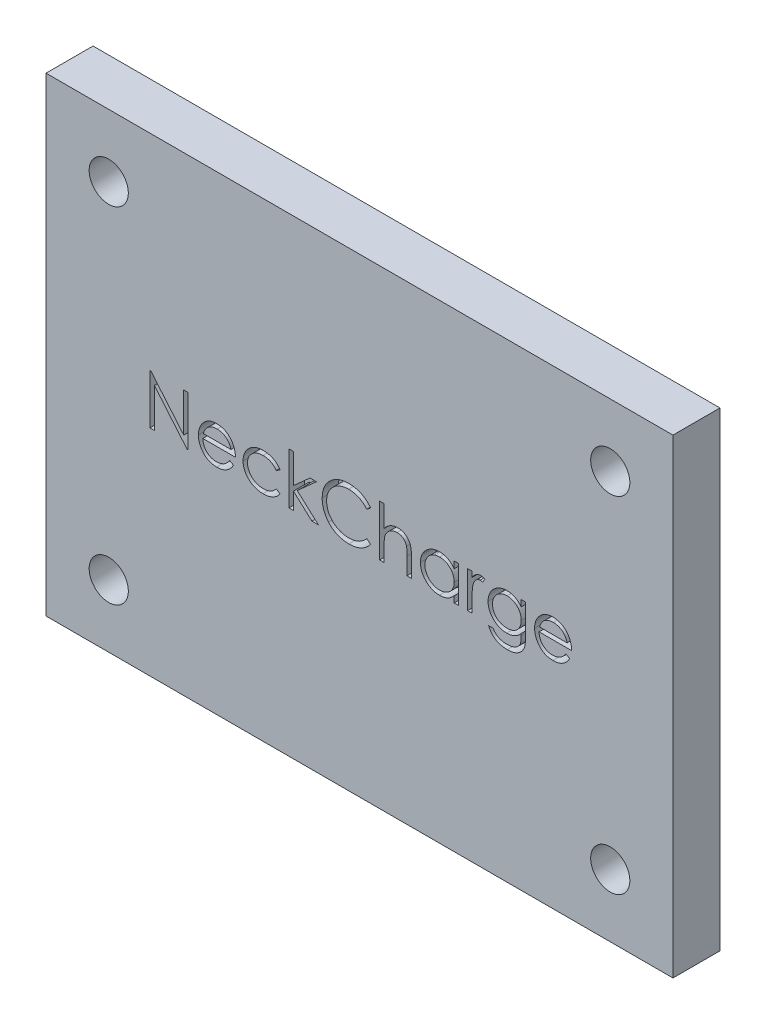
from build123d import *

# Parameters (mm, degrees)
SKETCH1_W           = 40
SKETCH1_H           = 30
SKETCH1_W_2         = 36
SKETCH1_H_2         = 26
EXTRUDE_THIN1_DEPTH = 1
SKETCH1_3_W         = 40
SKETCH1_3_H         = 30
SKETCH1_3_W_2       = 36
SKETCH1_3_H_2       = 26
BOSS_EXTRUDE1_DEPTH = 2
SKETCH2_R           = 1.25
CUT_EXTRUDE1_DEPTH  = 2
WRAP1_START         = -1
WRAP1_DEPTH         = 1


# Read off the part's stored shape, not the designer's step: Wrap1
with BuildPart() as part:
    # Sketch1 → Extrude-Thin1 (new body)
    # profile 1 of 2: a face of its own
    with BuildSketch(Plane.XY):
        with Locations((1.25, 0)):
            Rectangle(SKETCH1_W, SKETCH1_H)
        with Locations((1.25, 0)):
            Rectangle(SKETCH1_W_2, SKETCH1_H_2, mode=Mode.SUBTRACT)
    # profile 2 of 2: a face of its own
    with BuildSketch(Plane.XY):
        with Locations((1.25, 0)):
            Rectangle(SKETCH1_W, SKETCH1_H)
        with Locations((1.25, 0)):
            Rectangle(SKETCH1_W_2, SKETCH1_H_2, mode=Mode.SUBTRACT)
    extrude(amount=-EXTRUDE_THIN1_DEPTH)

    # Sketch1<3> → Boss-Extrude1 (add)
    # profile 1 of 2: a face of its own
    with BuildSketch(Plane.XY):
        with Locations((1.25, 0)):
            Rectangle(SKETCH1_3_W, SKETCH1_3_H)
        with Locations((1.25, 0)):
            Rectangle(SKETCH1_3_W_2, SKETCH1_3_H_2, mode=Mode.SUBTRACT)
    # profile 2 of 2: a face of its own
    with BuildSketch(Plane.XY):
        with Locations((1.25, 0)):
            Rectangle(SKETCH1_3_W_2, SKETCH1_3_H_2)
    extrude(amount=BOSS_EXTRUDE1_DEPTH)

    # Sketch2 → Cut-Extrude1 (cut)
    with BuildSketch(Plane(origin=(0, 0, 0), x_dir=(-1, 0, 0), z_dir=(0, 0, -1))):
        with Locations((-17.25, 11)):
            Circle(SKETCH2_R)
        with Locations((14.75, 11)):
            Circle(SKETCH2_R)
        with Locations((14.75, -11)):
            Circle(SKETCH2_R)
        with Locations((-17.25, -11)):
            Circle(SKETCH2_R)
    extrude(amount=-CUT_EXTRUDE1_DEPTH, mode=Mode.SUBTRACT)

    # Wrap1 outline → Wrap1 (cut)
    # profile 1 of 10: a face of its own
    with BuildSketch(Plane.XY.offset(2).offset(WRAP1_START)):
        with BuildLine():
            add(Edge.make_bspline(
                [(14.662320676, -0.641993919), (14.642148907, -0.677774655), (14.602902634, -0.747389798), (14.535410527, -0.843031557), (14.464660575, -0.929071985), (14.387459119, -1.003212457), (14.30611591, -1.067847642), (14.220179859, -1.124396955), (14.129203574, -1.172583041), (14.033182752, -1.213179977), (13.931311017, -1.244394304), (13.823341498, -1.266441704), (13.709067356, -1.280069955), (13.630739036, -1.281653047), (13.590630972, -1.28246367)],
                knots=[0, 0, 0, 0, 0.093369857, 0.181660766, 0.265874227, 0.346354784, 0.424599862, 0.501903184, 0.579992091, 0.658443431, 0.738672236, 0.821894148, 0.908800792, 1, 1, 1, 1], degree=3))
            Line((14.662320676, -0.641993919), (14.40918566, -0.509066234))
            add(Edge.make_bspline(
                [(13.555013985, -0.997527773), (13.583453955, -0.996976179), (13.63988431, -0.99588171), (13.723922802, -0.985239191), (13.806599373, -0.968030441), (13.887571837, -0.944544521), (13.965196818, -0.915899805), (14.037083853, -0.88133507), (14.10319662, -0.843099228), (14.16498844, -0.799366166), (14.224924269, -0.745837311), (14.284380668, -0.679039192), (14.348131632, -0.600038363), (14.388036477, -0.540579081), (14.40918566, -0.509066234)],
                knots=[0, 0, 0, 0, 0.082592263, 0.163878894, 0.24565874, 0.327725695, 0.408609961, 0.485749086, 0.559169056, 0.630268476, 0.705306028, 0.792064966, 0.889796437, 1, 1, 1, 1], degree=3))
            add(Edge.make_bspline(
                [(12.708474522, -0.142720081), (12.709871165, -0.173291216), (12.712617607, -0.233408121), (12.725422058, -0.321374474), (12.745604874, -0.405170292), (12.773970381, -0.484167051), (12.80832102, -0.559396524), (12.850399491, -0.630300657), (12.900600372, -0.696556494), (12.9565944, -0.758756683), (13.01892155, -0.814147516), (13.084492328, -0.863724485), (13.154245776, -0.905276705), (13.227631895, -0.939004176), (13.304532014, -0.965407763), (13.384970363, -0.983430714), (13.468788654, -0.995502161), (13.525925713, -0.996844429), (13.555013985, -0.997527773)],
                knots=[0, 0, 0, 0, 0.068384615, 0.134475588, 0.198391058, 0.260753477, 0.321829223, 0.383037238, 0.444653123, 0.507398011, 0.569825238, 0.630777641, 0.690928687, 0.750945133, 0.811049477, 0.872330853, 0.935004094, 1, 1, 1, 1], degree=3))
            Line((12.708474522, -0.142720081), (14.78443606, -0.142720081))
            add(Edge.make_bspline(
                [(14.531937062, 0.662478237), (14.552009356, 0.635079274), (14.592020337, 0.580463723), (14.642137349, 0.491408459), (14.685641557, 0.398235277), (14.720415029, 0.299438079), (14.748572291, 0.19618746), (14.768943834, 0.087745294), (14.780890559, -0.025856125), (14.783238877, -0.103259501), (14.78443606, -0.142720081)],
                knots=[0, 0, 0, 0, 0.11852184, 0.236254763, 0.356174434, 0.477249655, 0.601539871, 0.729618382, 0.862158266, 1, 1, 1, 1], degree=3))
            add(Edge.make_bspline(
                [(13.597627166, 1.119138894), (13.645204637, 1.117910578), (13.738540788, 1.115500903), (13.874641355, 1.0931613), (14.003420005, 1.057735054), (14.124825206, 1.007702687), (14.238869265, 0.943150808), (14.344810896, 0.863193566), (14.444461911, 0.77028573), (14.502436121, 0.698836247), (14.531937062, 0.662478237)],
                knots=[0, 0, 0, 0, 0.132040234, 0.259032841, 0.381879824, 0.502258444, 0.62275219, 0.744742632, 0.870108927, 1, 1, 1, 1], degree=3))
            add(Edge.make_bspline(
                [(12.690666028, 0.686646907), (12.719429426, 0.720999382), (12.776045071, 0.788616132), (12.871799764, 0.877460185), (12.975486371, 0.95188561), (13.085805489, 1.013577798), (13.204039291, 1.060453177), (13.328598433, 1.095385055), (13.460901215, 1.114959394), (13.551348094, 1.117724215), (13.597627166, 1.119138894)],
                knots=[0, 0, 0, 0, 0.128835254, 0.253589335, 0.374643257, 0.495340042, 0.616324775, 0.739759335, 0.86684232, 1, 1, 1, 1], degree=3))
            add(Edge.make_bspline(
                [(12.423538624, -0.088022564), (12.424499417, -0.05237654), (12.426403581, 0.018269174), (12.438405795, 0.122831489), (12.459676747, 0.2244573), (12.488865269, 0.323231049), (12.526558185, 0.418987356), (12.57267027, 0.5117845), (12.627273355, 0.601523734), (12.669430709, 0.658132291), (12.690666028, 0.686646907)],
                knots=[0, 0, 0, 0, 0.128044808, 0.2537679, 0.377428427, 0.500550841, 0.623295883, 0.746578332, 0.872347541, 1, 1, 1, 1], degree=3))
            add(Edge.make_bspline(
                [(13.590630972, -1.28246367), (13.546052178, -1.281423018), (13.459091866, -1.279393008), (13.332509381, -1.261891987), (13.21332948, -1.233342061), (13.101558864, -1.193459034), (12.997471249, -1.141364247), (12.900859759, -1.077901003), (12.811216332, -1.003395315), (12.731365799, -0.917201827), (12.659480277, -0.824961766), (12.596047569, -0.728844642), (12.543018328, -0.629092288), (12.499881317, -0.526339742), (12.465042618, -0.421234638), (12.440761394, -0.312820664), (12.426764409, -0.201391241), (12.424619519, -0.126010087), (12.423538624, -0.088022564)],
                knots=[0, 0, 0, 0, 0.071578658, 0.139629225, 0.204796697, 0.268134963, 0.329813747, 0.391301398, 0.453433515, 0.51655169, 0.579631271, 0.641118921, 0.701294047, 0.760810336, 0.819931722, 0.878919575, 0.938982822, 1, 1, 1, 1], degree=3))
        make_face()
        with BuildLine():
            add(Edge.make_bspline(
                [(13.612255572, 0.834202996), (13.583817152, 0.833648123), (13.527600376, 0.832551255), (13.444777265, 0.822146209), (13.365239252, 0.804946921), (13.288399455, 0.781392996), (13.215264811, 0.74999805), (13.144330985, 0.713183265), (13.077401626, 0.668241972), (13.035544879, 0.633989296), (13.014399001, 0.616684968)],
                knots=[0, 0, 0, 0, 0.131091976, 0.259141276, 0.384161763, 0.505991952, 0.629098089, 0.750669123, 0.874038938, 1, 1, 1, 1], degree=3))
            add(Edge.make_bspline(
                [(14.499500163, 0.142215817), (14.489071082, 0.180009995), (14.468998459, 0.252751622), (14.427055471, 0.353481573), (14.379819145, 0.443005598), (14.323919431, 0.52063855), (14.260583873, 0.589584594), (14.187427172, 0.649835739), (14.105388897, 0.703735856), (14.014893105, 0.749231337), (13.919060914, 0.787957138), (13.818725297, 0.813924207), (13.716347161, 0.831712863), (13.647101058, 0.833369405), (13.612255572, 0.834202996)],
                knots=[0, 0, 0, 0, 0.096240125, 0.185231261, 0.267500523, 0.344400382, 0.419594869, 0.496890627, 0.576637919, 0.660267852, 0.745386615, 0.830040327, 0.914474212, 1, 1, 1, 1], degree=3))
            Line((14.499500163, 0.142215817), (12.73836735, 0.142215817))
            add(Edge.make_bspline(
                [(13.014399001, 0.616684968), (12.99925581, 0.602992267), (12.968609681, 0.575281578), (12.927660779, 0.527539369), (12.888453636, 0.476057595), (12.852772394, 0.418866661), (12.820044869, 0.356617811), (12.789419747, 0.289836099), (12.76185493, 0.21801476), (12.746346316, 0.167965475), (12.73836735, 0.142215817)],
                knots=[0, 0, 0, 0, 0.109983845, 0.222580497, 0.338499871, 0.458708565, 0.585535346, 0.717517743, 0.85466682, 1, 1, 1, 1], degree=3))
        make_face(mode=Mode.SUBTRACT)
    # profile 2 of 10: a face of its own
    with BuildSketch(Plane.XY.offset(2).offset(WRAP1_START)):
        with BuildLine():
            add(Edge.make_bspline(
                [(11.853672014, -0.768387875), (11.853420697, -0.807610551), (11.852935594, -0.883319761), (11.849442213, -0.992792201), (11.842075598, -1.093907864), (11.833722009, -1.187127913), (11.821705345, -1.272020256), (11.807031069, -1.348838206), (11.790488703, -1.41765548), (11.775956077, -1.460041586), (11.769081669, -1.480091601)],
                knots=[0, 0, 0, 0, 0.163445255, 0.315488713, 0.456290824, 0.58586415, 0.705428686, 0.813370713, 0.911718238, 1, 1, 1, 1], degree=3))
            Line((11.853672014, -0.768387875), (11.853672014, 1.072883158))
            Line((11.853672014, 1.072883158), (11.568736116, 1.072883158))
            Line((11.568736116, 1.072883158), (11.568736116, 0.667103911))
            add(Edge.make_bspline(
                [(10.650326661, 1.113588286), (10.693008584, 1.11235759), (10.777292268, 1.109927343), (10.90132682, 1.090858161), (11.021017281, 1.060456163), (11.137039052, 1.016899127), (11.25033725, 0.957435878), (11.360538466, 0.879110489), (11.467961538, 0.781220395), (11.53425357, 0.706151725), (11.568736116, 0.667103911)],
                knots=[0, 0, 0, 0, 0.120911079, 0.238762229, 0.354754859, 0.470359399, 0.589144099, 0.716328905, 0.852445286, 1, 1, 1, 1], degree=3))
            add(Edge.make_bspline(
                [(9.45206945, -0.079580784), (9.452540408, -0.053270833), (9.4534805, -0.000752832), (9.461600317, 0.077152039), (9.473182888, 0.154013741), (9.491514222, 0.229040026), (9.513578224, 0.303085337), (9.540904608, 0.375602751), (9.573760197, 0.446614356), (9.610961898, 0.516172738), (9.652766754, 0.583344503), (9.698606933, 0.647140817), (9.748537776, 0.70709223), (9.801870442, 0.763803556), (9.859256133, 0.816727625), (9.920665162, 0.865735986), (9.985492203, 0.911650138), (10.053938173, 0.953479708), (10.124946947, 0.990475032), (10.196714482, 1.024232173), (10.270191452, 1.051023839), (10.34400797, 1.074630507), (10.419464035, 1.091353863), (10.495634457, 1.104255468), (10.572780006, 1.112115608), (10.624444418, 1.11309676), (10.650326661, 1.113588286)],
                knots=[0, 0, 0, 0, 0.042034119, 0.083905433, 0.125068934, 0.16615847, 0.207210273, 0.248490732, 0.289878112, 0.332169514, 0.374475842, 0.41622498, 0.457609587, 0.49907317, 0.540553362, 0.582248849, 0.62454975, 0.667432801, 0.710322543, 0.752467119, 0.794064757, 0.835215707, 0.876228344, 0.917446189, 0.95864314, 1, 1, 1, 1], degree=3))
            add(Edge.make_bspline(
                [(10.641422414, -1.247309149), (10.614900941, -1.246841947), (10.56217185, -1.245913071), (10.483835758, -1.23778618), (10.406655646, -1.225994463), (10.330811515, -1.208684872), (10.256193923, -1.186467378), (10.182926179, -1.158693622), (10.110415051, -1.127292764), (10.039978585, -1.090306007), (9.972318309, -1.049155914), (9.907944563, -1.004579921), (9.847194531, -0.956811331), (9.79064643, -0.905379107), (9.738374435, -0.850357688), (9.689675498, -0.792333607), (9.645354904, -0.730496635), (9.604503187, -0.665974323), (9.569072409, -0.598336914), (9.537971586, -0.52905107), (9.510930197, -0.45826494), (9.489371583, -0.385741533), (9.47290593, -0.311526571), (9.460650224, -0.235741636), (9.45369885, -0.158153355), (9.452614883, -0.10588256), (9.45206945, -0.079580784)],
                knots=[0, 0, 0, 0, 0.042864759, 0.085222258, 0.127202284, 0.169025313, 0.210882033, 0.252962678, 0.295628285, 0.338553294, 0.381463248, 0.423581562, 0.465066165, 0.506312219, 0.547039505, 0.587675833, 0.628674786, 0.669946465, 0.711035574, 0.751995829, 0.792672607, 0.833446018, 0.874190607, 0.915493583, 0.957477807, 1, 1, 1, 1], degree=3))
            add(Edge.make_bspline(
                [(11.568736116, -0.802732827), (11.539815388, -0.837151462), (11.482482639, -0.905383319), (11.383470421, -0.994792803), (11.275323648, -1.07179665), (11.158226434, -1.134950697), (11.0350471, -1.185461704), (10.907119791, -1.220788532), (10.775591284, -1.243612156), (10.686462548, -1.246068079), (10.641422414, -1.247309149)],
                knots=[0, 0, 0, 0, 0.126560713, 0.250895262, 0.374719265, 0.499826424, 0.624963531, 0.749039475, 0.87318012, 1, 1, 1, 1], degree=3))
            Line((11.568736116, -0.802732827), (11.568736116, -0.922940159))
            add(Edge.make_bspline(
                [(10.650326661, -1.857886073), (10.700008055, -1.856588723), (10.795788808, -1.854087564), (10.933521369, -1.833729333), (11.059246777, -1.799644861), (11.172240673, -1.751921539), (11.271169835, -1.693455813), (11.356452141, -1.62814146), (11.42552624, -1.554498693), (11.471983717, -1.486660912), (11.500862263, -1.426223308), (11.519252078, -1.374196311), (11.534196321, -1.315365486), (11.546696603, -1.249928068), (11.557011645, -1.177790565), (11.563545689, -1.098788035), (11.568268103, -1.013100026), (11.568576505, -0.953688393), (11.568736116, -0.922940159)],
                knots=[0, 0, 0, 0, 0.098171298, 0.189264436, 0.274463056, 0.355023171, 0.430920462, 0.501086045, 0.566607627, 0.629720863, 0.662710695, 0.698765562, 0.738610537, 0.782581228, 0.830408787, 0.882577866, 0.939228681, 1, 1, 1, 1], degree=3))
            add(Edge.make_bspline(
                [(9.777710475, -1.410129662), (9.800626908, -1.446511421), (9.845425712, -1.517633279), (9.929198977, -1.609720214), (10.021007573, -1.688417909), (10.123949857, -1.751836968), (10.23845416, -1.799652279), (10.364589368, -1.833738441), (10.503381882, -1.854145768), (10.600009119, -1.856605299), (10.650326661, -1.857886073)],
                knots=[0, 0, 0, 0, 0.124716487, 0.243805374, 0.360061534, 0.475112, 0.593525098, 0.71935017, 0.853854771, 1, 1, 1, 1], degree=3))
            Line((9.777710475, -1.410129662), (9.492774578, -1.410129662))
            add(Edge.make_bspline(
                [(10.677675419, -2.14282197), (10.62970141, -2.142045015), (10.535995281, -2.140527413), (10.399375037, -2.122846369), (10.269622113, -2.097850616), (10.148450999, -2.060017835), (10.036627411, -2.013719995), (9.934915038, -1.960566002), (9.844226962, -1.8996157), (9.762471916, -1.830218726), (9.688683473, -1.747701672), (9.619262289, -1.650457006), (9.552441291, -1.537003471), (9.51328117, -1.453734367), (9.492774578, -1.410129662)],
                knots=[0, 0, 0, 0, 0.096491424, 0.188473675, 0.276839915, 0.362136562, 0.443436755, 0.520165521, 0.592709664, 0.662917334, 0.7354188, 0.81488097, 0.903060556, 1, 1, 1, 1], degree=3))
            add(Edge.make_bspline(
                [(11.769081669, -1.480091601), (11.758931431, -1.506153745), (11.738934441, -1.55749879), (11.701482473, -1.630282781), (11.659541718, -1.698814149), (11.611638451, -1.762710979), (11.557989293, -1.821652507), (11.499858225, -1.876919278), (11.436113123, -1.927342058), (11.366790434, -1.972050864), (11.293488181, -2.012316263), (11.216248503, -2.047192792), (11.135506948, -2.077570143), (11.050505039, -2.100323822), (10.96257547, -2.120040318), (10.870684229, -2.132871569), (10.775368191, -2.141604686), (10.710557025, -2.142412254), (10.677675419, -2.14282197)],
                knots=[0, 0, 0, 0, 0.061370706, 0.120906468, 0.179423665, 0.237606687, 0.295938468, 0.354218227, 0.413537067, 0.474086783, 0.535121189, 0.596987665, 0.660019834, 0.724277496, 0.79001185, 0.857747684, 0.927829032, 1, 1, 1, 1], degree=3))
        make_face()
        with BuildLine():
            add(Edge.make_bspline(
                [(9.737005347, -0.091029101), (9.737663712, -0.121811427), (9.738958524, -0.18235126), (9.751407769, -0.271194922), (9.771529074, -0.355813492), (9.800047111, -0.436212089), (9.83538277, -0.512851867), (9.879825849, -0.585204887), (9.932123516, -0.653335585), (9.991866437, -0.716740046), (10.057703583, -0.774489639), (10.129113143, -0.825233433), (10.205998262, -0.866735873), (10.286468011, -0.902605061), (10.372474912, -0.928802501), (10.462780154, -0.948794822), (10.558022621, -0.960232767), (10.622948413, -0.961650448), (10.65605082, -0.962373252)],
                knots=[0, 0, 0, 0, 0.064983044, 0.127802645, 0.189056336, 0.248394647, 0.307690706, 0.366976619, 0.427340044, 0.488794715, 0.550673693, 0.612045111, 0.673369139, 0.734929754, 0.797809968, 0.862891673, 0.930095338, 1, 1, 1, 1], degree=3))
            add(Edge.make_bspline(
                [(10.673223296, 0.828652389), (10.631557586, 0.82723628), (10.549068315, 0.824432683), (10.428156747, 0.800497979), (10.311428386, 0.762991341), (10.201114891, 0.70934054), (10.09778487, 0.643940767), (10.006095568, 0.564710649), (9.92589968, 0.474226599), (9.858060872, 0.373306732), (9.804057418, 0.264429382), (9.765827316, 0.149666073), (9.741107652, 0.030871187), (9.738379282, -0.050202531), (9.737005347, -0.091029101)],
                knots=[0, 0, 0, 0, 0.085518899, 0.169309287, 0.252217903, 0.336756454, 0.420595494, 0.502741104, 0.584803551, 0.668268485, 0.75182313, 0.833628628, 0.916219799, 1, 1, 1, 1], degree=3))
            add(Edge.make_bspline(
                [(11.568736116, -0.074492643), (11.567520937, -0.03220359), (11.565146903, 0.05041436), (11.542743052, 0.170798356), (11.506620433, 0.283981368), (11.455959451, 0.389605431), (11.392475771, 0.48655138), (11.31601193, 0.573023725), (11.227886602, 0.649133787), (11.128352983, 0.712541434), (11.021267086, 0.76376365), (10.909215715, 0.802191829), (10.792365225, 0.8239581), (10.713165839, 0.82707862), (10.673223296, 0.828652389)],
                knots=[0, 0, 0, 0, 0.089242793, 0.174349058, 0.257613109, 0.339527367, 0.42099739, 0.501579059, 0.58254176, 0.666132658, 0.750049131, 0.83274294, 0.915647421, 1, 1, 1, 1], degree=3))
            add(Edge.make_bspline(
                [(10.65605082, -0.962373252), (10.689582229, -0.961676921), (10.755152545, -0.960315253), (10.850920465, -0.948609936), (10.941664451, -0.929721429), (11.027301297, -0.902903542), (11.108154342, -0.868684525), (11.183315314, -0.825380594), (11.254395806, -0.776064288), (11.319126264, -0.718540532), (11.3776589, -0.655144858), (11.428668238, -0.586161275), (11.472133488, -0.512627804), (11.508126803, -0.434552734), (11.535605253, -0.351329314), (11.554037402, -0.263165591), (11.566924949, -0.17048395), (11.568123217, -0.106976133), (11.568736116, -0.074492643)],
                knots=[0, 0, 0, 0, 0.070121499, 0.137121849, 0.201487121, 0.263765119, 0.324560095, 0.384738887, 0.444904604, 0.50523192, 0.565493995, 0.625099744, 0.684349714, 0.743882825, 0.804608206, 0.867238914, 0.932094288, 1, 1, 1, 1], degree=3))
        make_face(mode=Mode.SUBTRACT)
    # profile 3 of 10: a face of its own
    with BuildSketch(Plane.XY.offset(2).offset(WRAP1_START)):
        with BuildLine():
            add(Edge.make_bspline(
                [(8.434443517, 0.728908549), (8.455479034, 0.760709193), (8.495709297, 0.821527678), (8.562577454, 0.901963401), (8.631069762, 0.968561336), (8.70151411, 1.021632386), (8.774428529, 1.061377143), (8.848212764, 1.090490111), (8.924027654, 1.107705247), (8.974974543, 1.110003637), (9.000499206, 1.111155143)],
                knots=[0, 0, 0, 0, 0.160059412, 0.306112383, 0.438366514, 0.560541455, 0.675317225, 0.786113634, 0.892841788, 1, 1, 1, 1], degree=3))
            Line((8.434443517, 0.728908549), (8.434443517, 1.070450015))
            Line((8.434443517, 1.070450015), (8.14950762, 1.070450015))
            Line((8.14950762, 1.070450015), (8.14950762, -1.249742292))
            Line((8.14950762, -1.249742292), (8.434443517, -1.249742292))
            Line((8.434443517, -1.249742292), (8.434443517, -0.46998468))
            add(Edge.make_bspline(
                [(8.485324927, 0.32630939), (8.48103197, 0.307915097), (8.471523397, 0.267173135), (8.462278217, 0.198821259), (8.453143725, 0.118064083), (8.446706079, 0.024676817), (8.440738855, -0.081107329), (8.43737328, -0.199449508), (8.434558288, -0.330471191), (8.434482935, -0.422069354), (8.434443517, -0.46998468)],
                knots=[0, 0, 0, 0, 0.070854869, 0.15693815, 0.258600395, 0.37589093, 0.508166168, 0.656237809, 0.82017677, 1, 1, 1, 1], degree=3))
            add(Edge.make_bspline(
                [(8.946437708, 0.826219246), (8.923572507, 0.824695212), (8.876934124, 0.821586625), (8.8084589, 0.797149278), (8.742013221, 0.757665667), (8.689243213, 0.713876873), (8.648383455, 0.671651371), (8.619227679, 0.634777463), (8.592482615, 0.593431133), (8.566928201, 0.548319205), (8.543645206, 0.498671416), (8.521914899, 0.444983787), (8.502267216, 0.387194134), (8.49106378, 0.346932848), (8.485324927, 0.32630939)],
                knots=[0, 0, 0, 0, 0.093806529, 0.191338128, 0.295190617, 0.410312337, 0.471930251, 0.536425159, 0.603118728, 0.674117672, 0.749332023, 0.828283384, 0.912039809, 1, 1, 1, 1], degree=3))
            add(Edge.make_bspline(
                [(9.092085745, 0.7848781), (9.078379704, 0.790992484), (9.052363015, 0.802598756), (9.01430423, 0.816334723), (8.979214732, 0.824422732), (8.956859504, 0.825648026), (8.946437708, 0.826219246)],
                knots=[0, 0, 0, 0, 0.295138801, 0.560229945, 0.794983357, 1, 1, 1, 1], degree=3))
            Line((9.092085745, 0.7848781), (9.248546081, 1.03165294))
            add(Edge.make_bspline(
                [(9.000499206, 1.111155143), (9.020298802, 1.110075166), (9.061037758, 1.107853041), (9.122707679, 1.092240365), (9.186247096, 1.067313873), (9.22719769, 1.0438731), (9.248546081, 1.03165294)],
                knots=[0, 0, 0, 0, 0.225277548, 0.463523195, 0.720323555, 1, 1, 1, 1], degree=3))
        make_face()
    # profile 4 of 10: a face of its own
    with BuildSketch(Plane.XY.offset(2).offset(WRAP1_START)):
        with BuildLine():
            add(Edge.make_bspline(
                [(7.294705183, -0.854041812), (7.26257528, -0.890363444), (7.19987337, -0.961245565), (7.095151784, -1.053848678), (6.984146366, -1.13039187), (6.867395882, -1.192213579), (6.745005761, -1.238652088), (6.61724731, -1.271659532), (6.484068415, -1.292881082), (6.393125207, -1.295000188), (6.347038916, -1.296074064)],
                knots=[0, 0, 0, 0, 0.134298379, 0.262084975, 0.386269912, 0.507164597, 0.627300236, 0.748144942, 0.872370177, 1, 1, 1, 1], degree=3))
            Line((7.294705183, -0.854041812), (7.294705183, -1.255368936))
            Line((7.294705183, -1.255368936), (7.57964108, -1.255368936))
            Line((7.57964108, -1.255368936), (7.57964108, 1.064823372))
            Line((7.57964108, 1.064823372), (7.294705183, 1.064823372))
            Line((7.294705183, 1.064823372), (7.294705183, 0.635511473))
            add(Edge.make_bspline(
                [(6.355943163, 1.1055285), (6.403295893, 1.104224254), (6.49615236, 1.101666689), (6.631977054, 1.080382644), (6.76046883, 1.044424892), (6.882619564, 0.995514018), (6.997990615, 0.930518385), (7.105489751, 0.848530849), (7.206242011, 0.750068487), (7.264644132, 0.674439584), (7.294705183, 0.635511473)],
                knots=[0, 0, 0, 0, 0.129862142, 0.254653531, 0.376014554, 0.495255252, 0.614797719, 0.738105554, 0.8651963, 1, 1, 1, 1], degree=3))
            add(Edge.make_bspline(
                [(5.137333388, -0.088912605), (5.138470012, -0.048577674), (5.140717056, 0.031162309), (5.157456763, 0.148436556), (5.185606321, 0.261392407), (5.225110439, 0.369666205), (5.27576707, 0.473388965), (5.337387549, 0.572634045), (5.409976326, 0.667674855), (5.493662438, 0.756276611), (5.584317551, 0.838119597), (5.681299043, 0.909247803), (5.782194448, 0.970676658), (5.888568751, 1.019348026), (5.998847481, 1.058726285), (6.114012393, 1.085970478), (6.233584325, 1.102024476), (6.314764986, 1.104349269), (6.355943163, 1.1055285)],
                knots=[0, 0, 0, 0, 0.063774532, 0.12607881, 0.186904093, 0.247573935, 0.308003356, 0.369131898, 0.432033228, 0.496790794, 0.561610823, 0.624913866, 0.686726349, 0.748078833, 0.809582291, 0.871630743, 0.934885821, 1, 1, 1, 1], degree=3))
            add(Edge.make_bspline(
                [(6.347038916, -1.296074064), (6.30606513, -1.294961569), (6.225263008, -1.29276768), (6.106400917, -1.27574759), (5.992017233, -1.248414812), (5.882003871, -1.210404719), (5.777072711, -1.159984974), (5.676325337, -1.099622556), (5.580283681, -1.027739803), (5.490411642, -0.94556352), (5.407651184, -0.85630521), (5.335024173, -0.761104607), (5.274469593, -0.660373374), (5.223832806, -0.555386871), (5.184828979, -0.445336908), (5.157638611, -0.330604048), (5.140638348, -0.211323949), (5.138445366, -0.13009881), (5.137333388, -0.088912605)],
                knots=[0, 0, 0, 0, 0.064619991, 0.127433484, 0.189004127, 0.249930071, 0.310668454, 0.372328961, 0.43493911, 0.499575544, 0.564191208, 0.626735217, 0.688109334, 0.749293607, 0.810330528, 0.87190117, 0.935045915, 1, 1, 1, 1], degree=3))
        make_face()
        with BuildLine():
            add(Edge.make_bspline(
                [(5.422269285, -0.092092694), (5.42396101, -0.131635148), (5.427337828, -0.210565064), (5.451604529, -0.327568873), (5.492316986, -0.441555039), (5.547872286, -0.551556083), (5.61743801, -0.653685946), (5.698072716, -0.745978771), (5.790556185, -0.825344326), (5.892997567, -0.891781268), (6.002406226, -0.945450126), (6.117462721, -0.982793242), (6.236004192, -1.006903086), (6.316605952, -1.00971929), (6.357215199, -1.011138166)],
                knots=[0, 0, 0, 0, 0.081589349, 0.162858895, 0.245483689, 0.330807139, 0.416493374, 0.499893203, 0.583048156, 0.667157852, 0.751311929, 0.833784789, 0.916256489, 1, 1, 1, 1], degree=3))
            add(Edge.make_bspline(
                [(6.359759269, 0.820592603), (6.318108405, 0.81911066), (6.235896225, 0.816185541), (6.115206309, 0.793349584), (5.999714855, 0.755354274), (5.889999488, 0.703391406), (5.78779332, 0.638051052), (5.696449776, 0.559019512), (5.615221754, 0.468453078), (5.5469064, 0.366760449), (5.491216449, 0.257741752), (5.452057784, 0.14378244), (5.42623211, 0.026937925), (5.423593666, -0.052312512), (5.422269285, -0.092092694)],
                knots=[0, 0, 0, 0, 0.085920517, 0.169593435, 0.252475515, 0.336244477, 0.419504521, 0.502035907, 0.584774648, 0.669846475, 0.754184866, 0.836658238, 0.918009726, 1, 1, 1, 1], degree=3))
            add(Edge.make_bspline(
                [(7.294705183, -0.100360923), (7.293834637, -0.068304462), (7.292121128, -0.005207203), (7.27903054, 0.087437045), (7.258207143, 0.176095496), (7.228864546, 0.260861364), (7.19031888, 0.341265985), (7.143829836, 0.417886682), (7.088579892, 0.490324952), (7.025458446, 0.55758331), (6.956365727, 0.618930172), (6.883254965, 0.673689162), (6.805259959, 0.718673262), (6.723692361, 0.755903559), (6.63841065, 0.785530073), (6.548720874, 0.805294624), (6.455576364, 0.818865772), (6.392034585, 0.820010932), (6.359759269, 0.820592603)],
                knots=[0, 0, 0, 0, 0.0656338, 0.129188088, 0.191218683, 0.251912818, 0.312507474, 0.373494434, 0.4351516, 0.498741474, 0.562095217, 0.624186567, 0.685475718, 0.746096815, 0.807611636, 0.869966581, 0.933951019, 1, 1, 1, 1], degree=3))
            add(Edge.make_bspline(
                [(6.357215199, -1.011138166), (6.398441669, -1.009632342), (6.48043703, -1.006637407), (6.601485, -0.983703687), (6.718955431, -0.94581342), (6.831248131, -0.893290641), (6.935856336, -0.828196468), (7.029743696, -0.751990036), (7.109133182, -0.66335929), (7.176436477, -0.565953508), (7.229209891, -0.459171911), (7.26765103, -0.345475895), (7.290378502, -0.224861502), (7.293243014, -0.14243494), (7.294705183, -0.100360923)],
                knots=[0, 0, 0, 0, 0.084802388, 0.16866354, 0.252551924, 0.338239689, 0.423102661, 0.505556051, 0.586175656, 0.66713572, 0.74849918, 0.830452399, 0.913455706, 1, 1, 1, 1], degree=3))
        make_face(mode=Mode.SUBTRACT)
    # profile 5 of 10: a face of its own
    with BuildSketch(Plane.XY.offset(2).offset(WRAP1_START)):
        with BuildLine():
            add(Edge.make_bspline(
                [(2.817145767, 0.621588869), (2.847732176, 0.659819481), (2.907285483, 0.734256442), (3.007521246, 0.831376237), (3.110455537, 0.915557843), (3.219643614, 0.982568901), (3.333082301, 1.035506622), (3.451250035, 1.07305113), (3.574168773, 1.096138911), (3.657648731, 1.099040333), (3.699938235, 1.100510143)],
                knots=[0, 0, 0, 0, 0.140723513, 0.273995891, 0.40068416, 0.522554679, 0.641533771, 0.759969143, 0.878404515, 1, 1, 1, 1], degree=3))
            Line((2.817145767, 0.621588869), (2.817145767, 1.996022963))
            Line((2.817145767, 1.996022963), (2.53220987, 1.996022963))
            Line((2.53220987, 1.996022963), (2.53220987, -1.260387293))
            Line((2.53220987, -1.260387293), (2.817145767, -1.260387293))
            Line((2.817145767, -1.260387293), (2.817145767, -0.421480041))
            add(Edge.make_bspline(
                [(2.861030983, 0.201181217), (2.85745736, 0.185740783), (2.849669995, 0.152094176), (2.841220111, 0.096600325), (2.833656538, 0.032114831), (2.827262496, -0.0412645), (2.823340839, -0.123806555), (2.81911515, -0.214948068), (2.817542151, -0.315259944), (2.817281844, -0.385015154), (2.817145767, -0.421480041)],
                knots=[0, 0, 0, 0, 0.075999078, 0.165611346, 0.269045027, 0.387447975, 0.518826658, 0.665393555, 0.825082798, 1, 1, 1, 1], degree=3))
            add(Edge.make_bspline(
                [(3.649692842, 0.815574245), (3.626771362, 0.815142603), (3.581410346, 0.814288394), (3.514146913, 0.805712357), (3.448896977, 0.791698163), (3.385032144, 0.77273476), (3.323905958, 0.746930594), (3.263736692, 0.717058208), (3.206229088, 0.680492863), (3.150361954, 0.639466631), (3.098366763, 0.594046206), (3.049991451, 0.546106468), (3.006867385, 0.495057036), (2.967798021, 0.441716931), (2.934072004, 0.385354518), (2.904632423, 0.326513315), (2.879653612, 0.26511594), (2.867241456, 0.222502849), (2.861030983, 0.201181217)],
                knots=[0, 0, 0, 0, 0.064019975, 0.126693877, 0.189084395, 0.250362632, 0.312516479, 0.374242602, 0.437850162, 0.502657326, 0.567745439, 0.630575914, 0.69277209, 0.754267546, 0.815120554, 0.876051359, 0.937981798, 1, 1, 1, 1], degree=3))
            add(Edge.make_bspline(
                [(4.249457466, 0.358913588), (4.239094043, 0.394921956), (4.219170424, 0.464147833), (4.172862616, 0.558184448), (4.115024085, 0.638362035), (4.044405498, 0.703598567), (3.962256125, 0.754771892), (3.8680403, 0.790211952), (3.762644752, 0.8122081), (3.688393774, 0.814420896), (3.649692842, 0.815574245)],
                knots=[0, 0, 0, 0, 0.136257396, 0.26195405, 0.379637675, 0.494379033, 0.609866212, 0.729887486, 0.859212548, 1, 1, 1, 1], degree=3))
            add(Edge.make_bspline(
                [(4.282530382, -0.168981043), (4.28235775, -0.137391907), (4.282027534, -0.076967266), (4.280935929, 0.009543418), (4.278499148, 0.088007769), (4.274561399, 0.158174318), (4.270420013, 0.220140886), (4.264720146, 0.273817486), (4.25808872, 0.319277839), (4.252129897, 0.346641466), (4.249457466, 0.358913588)],
                knots=[0, 0, 0, 0, 0.17886657, 0.342141307, 0.489870991, 0.623312103, 0.740055623, 0.841468004, 0.928901093, 1, 1, 1, 1], degree=3))
            Line((4.282530382, -0.168981043), (4.282530382, -1.260387293))
            Line((4.282530382, -1.260387293), (4.56746628, -1.260387293))
            Line((4.56746628, -1.260387293), (4.56746628, -0.075486452))
            add(Edge.make_bspline(
                [(3.699938235, 1.100510143), (3.742873663, 1.098926788), (3.826908651, 1.095827781), (3.949265407, 1.071322786), (4.063529915, 1.029451396), (4.169362501, 0.97214988), (4.264453476, 0.900782387), (4.348681477, 0.81838522), (4.417479915, 0.722886737), (4.464287686, 0.634661421), (4.494743563, 0.556158408), (4.514022005, 0.488815286), (4.530367992, 0.413774694), (4.544609896, 0.331075258), (4.554101859, 0.240319995), (4.561726048, 0.14191835), (4.567147546, 0.035875964), (4.567357644, -0.037530262), (4.56746628, -0.075486452)],
                knots=[0, 0, 0, 0, 0.077228553, 0.151154907, 0.223453638, 0.295497225, 0.366919857, 0.436794085, 0.506696431, 0.577863847, 0.61591181, 0.658048026, 0.703775986, 0.754080143, 0.808979421, 0.867913193, 0.931701816, 1, 1, 1, 1], degree=3))
        make_face()
    # profile 6 of 10: a face of its own
    with BuildSketch(Plane.XY.offset(2).offset(WRAP1_START)):
        with BuildLine():
            add(Edge.make_bspline(
                [(1.713025414, 1.134524128), (1.695240072, 1.155720401), (1.659909174, 1.197827174), (1.603068326, 1.256954332), (1.543830407, 1.312349248), (1.482218062, 1.36427581), (1.417122289, 1.410918162), (1.350119993, 1.454706948), (1.280090338, 1.493956968), (1.183251264, 1.541548391), (1.056570716, 1.591210974), (0.897099683, 1.632851763), (0.730628901, 1.659359544), (0.617056793, 1.662230507), (0.559289436, 1.663690795)],
                knots=[0, 0, 0, 0, 0.063163259, 0.125474941, 0.18712122, 0.248294346, 0.309294856, 0.369850066, 0.430973376, 0.49245599, 0.616147966, 0.740843698, 0.868182649, 1, 1, 1, 1], degree=3))
            Line((1.713025414, 1.134524128), (1.962344324, 1.325329416))
            add(Edge.make_bspline(
                [(0.57709793, 1.98933182), (0.613578201, 1.988894452), (0.685787223, 1.988028726), (0.792605701, 1.979586725), (0.896602669, 1.965513668), (0.997849774, 1.946358376), (1.096839576, 1.922584592), (1.192815509, 1.891614464), (1.286340746, 1.856202754), (1.376825441, 1.815419002), (1.463835455, 1.769638458), (1.547343687, 1.719368571), (1.626686808, 1.664671662), (1.702423121, 1.606012924), (1.773285684, 1.542151374), (1.841286454, 1.474843555), (1.904116146, 1.402150729), (1.942899401, 1.350983396), (1.962344324, 1.325329416)],
                knots=[0, 0, 0, 0, 0.068547537, 0.135682946, 0.20121499, 0.265682235, 0.329266835, 0.392395428, 0.455069762, 0.51712685, 0.578790035, 0.639739863, 0.700191504, 0.759806243, 0.819628319, 0.879354791, 0.939511608, 1, 1, 1, 1], degree=3))
            add(Edge.make_bspline(
                [(-1.131245419, 0.338866075), (-1.129834637, 0.395975665), (-1.12705901, 0.508335218), (-1.10347711, 0.673230161), (-1.065541487, 0.831210359), (-1.011660024, 0.981980899), (-0.943347313, 1.126334796), (-0.858958884, 1.263169317), (-0.75947512, 1.393359557), (-0.645676255, 1.514930081), (-0.520883029, 1.62609078), (-0.387243819, 1.723886407), (-0.245020196, 1.805273011), (-0.095779002, 1.873305244), (0.061597295, 1.925597007), (0.226772923, 1.962203112), (0.39943751, 1.984987925), (0.517241281, 1.987868292), (0.57709793, 1.98933182)],
                knots=[0, 0, 0, 0, 0.064557846, 0.127013532, 0.18795481, 0.248013913, 0.307747682, 0.368234515, 0.429469844, 0.492743437, 0.556257769, 0.618216786, 0.679655476, 0.741245546, 0.803415265, 0.866815462, 0.932328312, 1, 1, 1, 1], degree=3))
            add(Edge.make_bspline(
                [(-0.728646261, -0.793245303), (-0.760791452, -0.753747225), (-0.824693749, -0.675227923), (-0.906450619, -0.547968497), (-0.976434472, -0.415100908), (-1.033018343, -0.275927115), (-1.077253108, -0.130759414), (-1.107897478, 0.020475374), (-1.127810719, 0.177636007), (-1.13008791, 0.284530809), (-1.131245419, 0.338866075)],
                knots=[0, 0, 0, 0, 0.12432851, 0.247156016, 0.368779749, 0.490733862, 0.613613772, 0.738957576, 0.867310575, 1, 1, 1, 1], degree=3))
            add(Edge.make_bspline(
                [(0.580914036, -1.348488693), (0.546765852, -1.348251028), (0.479242047, -1.347781075), (0.37954818, -1.340168181), (0.282493346, -1.329781634), (0.188354935, -1.314142372), (0.096619229, -1.295687149), (0.008117842, -1.270948223), (-0.078020099, -1.243235765), (-0.161448522, -1.210664813), (-0.242238393, -1.173910847), (-0.320129136, -1.132371362), (-0.395084928, -1.08639567), (-0.467842703, -1.036997197), (-0.537327654, -0.982589216), (-0.604141923, -0.92392734), (-0.668660169, -0.861209287), (-0.708576891, -0.815983813), (-0.728646261, -0.793245303)],
                knots=[0, 0, 0, 0, 0.069662801, 0.137749562, 0.203916744, 0.268779862, 0.332413706, 0.39475354, 0.456180032, 0.516995649, 0.577395938, 0.637198344, 0.696999184, 0.756756194, 0.816553905, 0.876947997, 0.938131788, 1, 1, 1, 1], degree=3))
            add(Edge.make_bspline(
                [(1.962344324, -0.682578236), (1.942280039, -0.708466689), (1.902247575, -0.76011959), (1.837424945, -0.832937498), (1.769137682, -0.901430445), (1.696878574, -0.965046215), (1.621478863, -1.025057766), (1.541584694, -1.079760142), (1.458246357, -1.129916873), (1.371746223, -1.175842725), (1.282176196, -1.216589085), (1.189643601, -1.251472146), (1.094547293, -1.281521153), (0.996882925, -1.306242553), (0.896447917, -1.325538465), (0.793604701, -1.338437741), (0.688131314, -1.347275049), (0.61697374, -1.348080516), (0.580914036, -1.348488693)],
                knots=[0, 0, 0, 0, 0.061674239, 0.123053062, 0.183475001, 0.243726501, 0.304278917, 0.364862921, 0.425946204, 0.48739123, 0.549220384, 0.611143589, 0.67352853, 0.736961457, 0.800785283, 0.866012596, 0.932100748, 1, 1, 1, 1], degree=3))
            Line((1.962344324, -0.682578236), (1.713025414, -0.493681))
            add(Edge.make_bspline(
                [(0.579005983, -1.022847667), (0.634434851, -1.021315702), (0.743532122, -1.01830043), (0.903523118, -0.992755968), (1.056681276, -0.951337714), (1.203014837, -0.89337317), (1.342111266, -0.818021088), (1.474188237, -0.726673727), (1.599357233, -0.618462168), (1.674624039, -0.535836759), (1.713025414, -0.493681)],
                knots=[0, 0, 0, 0, 0.12851519, 0.252948636, 0.374754734, 0.495939754, 0.617180641, 0.740909469, 0.867811148, 1, 1, 1, 1], degree=3))
            add(Edge.make_bspline(
                [(-0.846309522, 0.317241476), (-0.845164872, 0.270313778), (-0.842917503, 0.178177469), (-0.822916514, 0.043221273), (-0.79252261, -0.086065339), (-0.746969908, -0.208874196), (-0.690800484, -0.326719635), (-0.619825072, -0.437607737), (-0.537622927, -0.543214192), (-0.443031133, -0.641043152), (-0.339248714, -0.730409174), (-0.227898823, -0.809104345), (-0.10925879, -0.874704274), (0.015361439, -0.929292454), (0.146920842, -0.971253914), (0.285182841, -1.000794226), (0.429846723, -1.020063918), (0.528697536, -1.021908764), (0.579005983, -1.022847667)],
                knots=[0, 0, 0, 0, 0.064323217, 0.126290104, 0.186726469, 0.246146432, 0.305575643, 0.365429386, 0.426326309, 0.488839906, 0.551724972, 0.613918596, 0.675483766, 0.737333897, 0.800229044, 0.864502298, 0.931040739, 1, 1, 1, 1], degree=3))
            add(Edge.make_bspline(
                [(0.559289436, 1.663690795), (0.527463872, 1.663324343), (0.464108114, 1.662594841), (0.370084142, 1.652970848), (0.277815874, 1.639444251), (0.18736333, 1.619373422), (0.098841646, 1.59399826), (0.01167211, 1.563676635), (-0.07288322, 1.526161887), (-0.15599405, 1.484697966), (-0.235622335, 1.437864498), (-0.310965128, 1.386780243), (-0.381747642, 1.332016848), (-0.448025868, 1.273369059), (-0.509867564, 1.211100995), (-0.566824625, 1.144549056), (-0.618699961, 1.073926013), (-0.666521834, 1.000163136), (-0.709350528, 0.923475283), (-0.745209776, 0.843578611), (-0.776964422, 0.761841318), (-0.802091592, 0.677339908), (-0.821980261, 0.59066897), (-0.835703213, 0.501595898), (-0.845217755, 0.410306775), (-0.845943629, 0.348431184), (-0.846309522, 0.317241476)],
                knots=[0, 0, 0, 0, 0.043954909, 0.087501875, 0.130462627, 0.172752021, 0.215403067, 0.25764983, 0.300152749, 0.34312149, 0.385925163, 0.427685727, 0.46881795, 0.5094918, 0.549883031, 0.589980023, 0.63040523, 0.670868626, 0.711383944, 0.751627258, 0.791775577, 0.832458919, 0.873319045, 0.914542956, 0.956923558, 1, 1, 1, 1], degree=3))
        make_face()
    # profile 7 of 10: a face of its own
    with BuildSketch(Plane.XY.offset(2).offset(WRAP1_START)):
        with BuildLine():
            add(Edge.make_bspline(
                [(-4.056281686, 0.392403391), (-4.082434492, 0.424904863), (-4.133911851, 0.488878491), (-4.223301016, 0.571437502), (-4.31856137, 0.642346176), (-4.421320742, 0.700134579), (-4.531435003, 0.744785466), (-4.648469904, 0.776381438), (-4.772408755, 0.796070287), (-4.857376471, 0.79830806), (-4.900913096, 0.799454673)],
                knots=[0, 0, 0, 0, 0.128324238, 0.252584475, 0.373506483, 0.493364451, 0.614608597, 0.738470244, 0.865994718, 1, 1, 1, 1], degree=3))
            Line((-4.056281686, 0.392403391), (-3.817775075, 0.540595499))
            add(Edge.make_bspline(
                [(-4.879924514, 1.084390571), (-4.841933273, 1.083554284), (-4.76614069, 1.08188589), (-4.653708763, 1.067844541), (-4.542932837, 1.046675078), (-4.435756536, 1.015312582), (-4.333479341, 0.977336266), (-4.237743611, 0.934689018), (-4.150802945, 0.885163914), (-4.071040061, 0.830989238), (-3.998305784, 0.769883274), (-3.931853495, 0.701115534), (-3.870320499, 0.625043914), (-3.835434767, 0.568977286), (-3.817775075, 0.540595499)],
                knots=[0, 0, 0, 0, 0.091268804, 0.182081405, 0.271909655, 0.362049459, 0.450066348, 0.533976474, 0.613602454, 0.690197614, 0.765412877, 0.841436551, 0.919732749, 1, 1, 1, 1], degree=3))
            add(Edge.make_bspline(
                [(-6.178672511, -0.13549124), (-6.178272446, -0.108115089), (-6.177476652, -0.053659405), (-6.168349046, 0.027162548), (-6.156557574, 0.106908157), (-6.136577084, 0.184566588), (-6.113498797, 0.261315673), (-6.08403885, 0.336230343), (-6.049480884, 0.409658725), (-6.010245189, 0.481411665), (-5.966077542, 0.550308748), (-5.917199566, 0.615399572), (-5.865452204, 0.677466074), (-5.808414588, 0.734365485), (-5.748507188, 0.788373316), (-5.684035116, 0.838046757), (-5.615368164, 0.883531799), (-5.543537579, 0.925669506), (-5.468585162, 0.963188422), (-5.390963968, 0.995512859), (-5.311141721, 1.023137696), (-5.228990733, 1.04500793), (-5.145056276, 1.063348021), (-5.058676919, 1.074884924), (-4.970183117, 1.083036757), (-4.910260868, 1.083935548), (-4.879924514, 1.084390571)],
                knots=[0, 0, 0, 0, 0.041291447, 0.082135503, 0.122636035, 0.16283087, 0.203006601, 0.243526083, 0.284172936, 0.325409811, 0.366854666, 0.407550595, 0.448187374, 0.488682851, 0.529014965, 0.569842729, 0.611370238, 0.653237735, 0.695446119, 0.737751395, 0.780043361, 0.82280707, 0.865978142, 0.90959503, 0.954231405, 1, 1, 1, 1], degree=3))
            add(Edge.make_bspline(
                [(-4.903457166, -1.317211993), (-4.948461325, -1.316403475), (-5.036669803, -1.314818774), (-5.165776649, -1.297393943), (-5.289160476, -1.271125248), (-5.406779129, -1.233421004), (-5.51865092, -1.184884529), (-5.624671535, -1.125596471), (-5.724489923, -1.05506449), (-5.81711899, -0.974543978), (-5.902192159, -0.887239968), (-5.975240917, -0.793033256), (-6.038600556, -0.695387449), (-6.08947997, -0.59214595), (-6.12998111, -0.484680933), (-6.157653351, -0.372131502), (-6.175551042, -0.255425528), (-6.177622393, -0.175839271), (-6.178672511, -0.13549124)],
                knots=[0, 0, 0, 0, 0.069558544, 0.136335251, 0.201095766, 0.264449955, 0.327004991, 0.389391387, 0.45197649, 0.515669983, 0.578973246, 0.640167029, 0.699739843, 0.758684985, 0.817820401, 0.876983987, 0.937634285, 1, 1, 1, 1], degree=3))
            add(Edge.make_bspline(
                [(-3.817775075, -0.78168515), (-3.831915348, -0.80245031), (-3.86014896, -0.843911707), (-3.907345449, -0.902371727), (-3.958254153, -0.95709211), (-4.012676462, -1.007999507), (-4.069901764, -1.056312138), (-4.131884939, -1.099720352), (-4.196627373, -1.140664084), (-4.264889109, -1.177505761), (-4.335964385, -1.21062221), (-4.409753189, -1.239098486), (-4.485934877, -1.263564225), (-4.564599018, -1.283010961), (-4.645900697, -1.298532936), (-4.729629651, -1.308832366), (-4.815757043, -1.316520656), (-4.873970352, -1.31697955), (-4.903457166, -1.317211993)],
                knots=[0, 0, 0, 0, 0.059633396, 0.119068862, 0.178196546, 0.236956648, 0.295931988, 0.355855769, 0.416473305, 0.4777416, 0.53990299, 0.602537515, 0.665422385, 0.729765256, 0.794828771, 0.86182654, 0.930010932, 1, 1, 1, 1], degree=3))
            Line((-3.817775075, -0.78168515), (-4.056281686, -0.625224814))
            add(Edge.make_bspline(
                [(-4.899005043, -1.032276096), (-4.856954269, -1.031097266), (-4.774313338, -1.028780553), (-4.653511587, -1.009250708), (-4.538504096, -0.977279698), (-4.429294954, -0.932695758), (-4.326083718, -0.875067226), (-4.229537252, -0.803984264), (-4.137734451, -0.721491776), (-4.083762193, -0.657703331), (-4.056281686, -0.625224814)],
                knots=[0, 0, 0, 0, 0.129981079, 0.255447312, 0.377298345, 0.498441779, 0.619372125, 0.741856502, 0.868563689, 1, 1, 1, 1], degree=3))
            add(Edge.make_bspline(
                [(-5.893736613, -0.110050535), (-5.892122578, -0.150662605), (-5.888916253, -0.231339533), (-5.863787072, -0.350427525), (-5.822653217, -0.465565444), (-5.766357881, -0.575935826), (-5.695167909, -0.678074809), (-5.611554227, -0.769681229), (-5.515470487, -0.848980054), (-5.407763301, -0.914722988), (-5.290961634, -0.967574371), (-5.166329182, -1.005227452), (-5.034884381, -1.027953533), (-4.944889689, -1.030816424), (-4.899005043, -1.032276096)],
                knots=[0, 0, 0, 0, 0.080525242, 0.159965477, 0.240321361, 0.322528528, 0.405023583, 0.486596636, 0.567865474, 0.651332773, 0.736237567, 0.821529069, 0.909004906, 1, 1, 1, 1], degree=3))
            add(Edge.make_bspline(
                [(-4.900913096, 0.799454673), (-4.93571015, 0.798495966), (-5.004242001, 0.796607819), (-5.104849726, 0.784805443), (-5.200682432, 0.763358764), (-5.292340789, 0.735100396), (-5.379172883, 0.697226919), (-5.461406216, 0.651135212), (-5.539770197, 0.597568389), (-5.611993955, 0.535510252), (-5.678060268, 0.468020032), (-5.735299997, 0.395672037), (-5.785135644, 0.320633278), (-5.824238904, 0.241029912), (-5.856238523, 0.158683064), (-5.877290334, 0.072038352), (-5.891319022, -0.017794198), (-5.892924056, -0.079042977), (-5.893736613, -0.110050535)],
                knots=[0, 0, 0, 0, 0.069521641, 0.136920982, 0.201969243, 0.26546155, 0.328247885, 0.390816717, 0.453550176, 0.517541982, 0.580738372, 0.641921509, 0.701596724, 0.76031288, 0.818756513, 0.87771808, 0.938094053, 1, 1, 1, 1], degree=3))
        make_face()
    # profile 8 of 10: a face of its own
    with BuildSketch(Plane.XY.offset(2).offset(WRAP1_START)):
        with BuildLine():
            add(Edge.make_bspline(
                [(-6.789244463, -0.682064742), (-6.809416231, -0.717845478), (-6.848662505, -0.787460622), (-6.916154612, -0.883102381), (-6.986904563, -0.969142809), (-7.06410602, -1.043283281), (-7.145449229, -1.107918466), (-7.23138528, -1.164467778), (-7.322361565, -1.212653864), (-7.418382386, -1.2532508), (-7.520254122, -1.284465127), (-7.628223641, -1.306512528), (-7.742497783, -1.320140778), (-7.820826103, -1.32172387), (-7.860934166, -1.322534494)],
                knots=[0, 0, 0, 0, 0.093369857, 0.181660766, 0.265874227, 0.346354784, 0.424599862, 0.501903184, 0.579992091, 0.658443431, 0.738672236, 0.821894148, 0.908800792, 1, 1, 1, 1], degree=3))
            Line((-6.789244463, -0.682064742), (-7.042379479, -0.549137058))
            add(Edge.make_bspline(
                [(-7.896551154, -1.037598596), (-7.868111184, -1.037047002), (-7.811680829, -1.035952533), (-7.727642337, -1.025310014), (-7.644965765, -1.008101264), (-7.563993302, -0.984615344), (-7.48636832, -0.955970629), (-7.414481286, -0.921405893), (-7.348368519, -0.883170052), (-7.286576699, -0.839436989), (-7.226640869, -0.785908134), (-7.167184471, -0.719110016), (-7.103433507, -0.640109187), (-7.063528662, -0.580649904), (-7.042379479, -0.549137058)],
                knots=[0, 0, 0, 0, 0.082592263, 0.163878894, 0.24565874, 0.327725695, 0.408609961, 0.485749086, 0.559169056, 0.630268476, 0.705306028, 0.792064966, 0.889796437, 1, 1, 1, 1], degree=3))
            add(Edge.make_bspline(
                [(-8.743090617, -0.182790904), (-8.741693974, -0.213362039), (-8.738947532, -0.273478944), (-8.72614308, -0.361445297), (-8.705960264, -0.445241115), (-8.677594757, -0.524237874), (-8.643244119, -0.599467347), (-8.601165647, -0.670371481), (-8.550964766, -0.736627317), (-8.494970739, -0.798827506), (-8.432643588, -0.85421834), (-8.36707281, -0.903795308), (-8.297319362, -0.945347528), (-8.223933244, -0.979075), (-8.147033124, -1.005478586), (-8.066594776, -1.023501538), (-7.982776485, -1.035572985), (-7.925639426, -1.036915253), (-7.896551154, -1.037598596)],
                knots=[0, 0, 0, 0, 0.068384615, 0.134475588, 0.198391058, 0.260753477, 0.321829223, 0.383037238, 0.444653123, 0.507398011, 0.569825238, 0.630777641, 0.690928687, 0.750945133, 0.811049477, 0.872330853, 0.935004094, 1, 1, 1, 1], degree=3))
            Line((-8.743090617, -0.182790904), (-6.667129078, -0.182790904))
            add(Edge.make_bspline(
                [(-6.919628077, 0.622407413), (-6.899555783, 0.59500845), (-6.859544802, 0.5403929), (-6.80942779, 0.451337636), (-6.765923581, 0.358164454), (-6.731150109, 0.259367256), (-6.702992848, 0.156116637), (-6.682621305, 0.047674471), (-6.67067458, -0.065926949), (-6.668326261, -0.143330324), (-6.667129078, -0.182790904)],
                knots=[0, 0, 0, 0, 0.11852184, 0.236254763, 0.356174434, 0.477249655, 0.601539871, 0.729618382, 0.862158266, 1, 1, 1, 1], degree=3))
            add(Edge.make_bspline(
                [(-7.853937972, 1.07906807), (-7.806360502, 1.077839755), (-7.71302435, 1.075430079), (-7.576923783, 1.053090477), (-7.448145133, 1.017664231), (-7.326739933, 0.967631864), (-7.212695874, 0.903079984), (-7.106754243, 0.823122743), (-7.007103228, 0.730214906), (-6.949129017, 0.658765423), (-6.919628077, 0.622407413)],
                knots=[0, 0, 0, 0, 0.132040234, 0.259032841, 0.381879824, 0.502258444, 0.62275219, 0.744742632, 0.870108927, 1, 1, 1, 1], degree=3))
            add(Edge.make_bspline(
                [(-8.76089911, 0.646576083), (-8.732135712, 0.680928558), (-8.675520068, 0.748545309), (-8.579765374, 0.837389362), (-8.476078767, 0.911814786), (-8.365759649, 0.973506974), (-8.247525848, 1.020382354), (-8.122966705, 1.055314232), (-7.990663924, 1.074888571), (-7.900217045, 1.077653391), (-7.853937972, 1.07906807)],
                knots=[0, 0, 0, 0, 0.128835254, 0.253589335, 0.374643257, 0.495340042, 0.616324775, 0.739759335, 0.86684232, 1, 1, 1, 1], degree=3))
            add(Edge.make_bspline(
                [(-9.028026514, -0.128093388), (-9.027065722, -0.092447363), (-9.025161558, -0.021801649), (-9.013159344, 0.082760666), (-8.991888392, 0.184386476), (-8.96269987, 0.283160226), (-8.925006953, 0.378916533), (-8.878894869, 0.471713676), (-8.824291783, 0.56145291), (-8.782134429, 0.618061467), (-8.76089911, 0.646576083)],
                knots=[0, 0, 0, 0, 0.128044808, 0.2537679, 0.377428427, 0.500550841, 0.623295883, 0.746578332, 0.872347541, 1, 1, 1, 1], degree=3))
            add(Edge.make_bspline(
                [(-7.860934166, -1.322534494), (-7.90551296, -1.321493842), (-7.992473273, -1.319463831), (-8.119055758, -1.30196281), (-8.238235659, -1.273412885), (-8.350006275, -1.233529858), (-8.45409389, -1.181435071), (-8.55070538, -1.117971827), (-8.640348807, -1.043466139), (-8.720199339, -0.95727265), (-8.792084862, -0.865032589), (-8.85551757, -0.768915465), (-8.908546811, -0.669163112), (-8.951683821, -0.566410565), (-8.98652252, -0.461305462), (-9.010803744, -0.352891487), (-9.02480073, -0.241462065), (-9.02694562, -0.16608091), (-9.028026514, -0.128093388)],
                knots=[0, 0, 0, 0, 0.071578658, 0.139629225, 0.204796697, 0.268134963, 0.329813747, 0.391301398, 0.453433515, 0.51655169, 0.579631271, 0.641118921, 0.701294047, 0.760810336, 0.819931722, 0.878919575, 0.938982822, 1, 1, 1, 1], degree=3))
        make_face()
        with BuildLine():
            add(Edge.make_bspline(
                [(-7.839309567, 0.794132173), (-7.867747986, 0.7935773), (-7.923964762, 0.792480431), (-8.006787874, 0.782075385), (-8.086325887, 0.764876098), (-8.163165683, 0.741322173), (-8.236300328, 0.709927226), (-8.307234154, 0.673112442), (-8.374163513, 0.628171148), (-8.41602026, 0.593918473), (-8.437166138, 0.576614144)],
                knots=[0, 0, 0, 0, 0.131091976, 0.259141276, 0.384161763, 0.505991952, 0.629098089, 0.750669123, 0.874038938, 1, 1, 1, 1], degree=3))
            add(Edge.make_bspline(
                [(-6.952064976, 0.102144994), (-6.962494057, 0.139939172), (-6.98256668, 0.212680799), (-7.024509668, 0.31341075), (-7.071745994, 0.402934774), (-7.127645707, 0.480567727), (-7.190981266, 0.549513771), (-7.264137967, 0.609764916), (-7.346176242, 0.663665032), (-7.436672034, 0.709160514), (-7.532504225, 0.747886314), (-7.632839842, 0.773853384), (-7.735217978, 0.79164204), (-7.80446408, 0.793298581), (-7.839309567, 0.794132173)],
                knots=[0, 0, 0, 0, 0.096240125, 0.185231261, 0.267500523, 0.344400382, 0.419594869, 0.496890627, 0.576637919, 0.660267852, 0.745386615, 0.830040327, 0.914474212, 1, 1, 1, 1], degree=3))
            Line((-6.952064976, 0.102144994), (-8.713197788, 0.102144994))
            add(Edge.make_bspline(
                [(-8.437166138, 0.576614144), (-8.452309329, 0.562921444), (-8.482955458, 0.535210755), (-8.52390436, 0.487468546), (-8.563111503, 0.435986772), (-8.598792745, 0.378795837), (-8.63152027, 0.316546988), (-8.662145392, 0.249765276), (-8.689710208, 0.177943936), (-8.705218823, 0.127894652), (-8.713197788, 0.102144994)],
                knots=[0, 0, 0, 0, 0.109983845, 0.222580497, 0.338499871, 0.458708565, 0.585535346, 0.717517743, 0.85466682, 1, 1, 1, 1], degree=3))
        make_face(mode=Mode.SUBTRACT)
    # profile 9 of 10: a face of its own
    with BuildSketch(Plane.XY.offset(2).offset(WRAP1_START)):
        Polygon((-2.962972354, 0.102613712), (-2.962972354, 1.985225891), (-3.247908251, 1.985225891), (-3.247908251, -1.271184365), (-2.962972354, -1.271184365), (-2.962972354, -0.202038732), (-1.784431689, -1.271184365), (-1.375472354, -1.271184365), (-2.72255769, -0.050030519), (-1.497587738, 1.049007943), (-1.907183091, 1.049007943), align=None)
    # profile 10 of 10: a face of its own
    with BuildSketch(Plane.XY.offset(2).offset(WRAP1_START)):
        Polygon((-12.061824919, 1.887087777), (-12.121610576, 1.887087777), (-12.121610576, -1.287912223), (-11.836674679, -1.287912223), (-11.836674679, 1.20527688), (-9.744176682, -1.287912223), (-9.679302884, -1.287912223), (-9.679302884, 1.887087777), (-9.964238782, 1.887087777), (-9.964238782, -0.611825484), align=None)
    extrude(amount=WRAP1_DEPTH, mode=Mode.SUBTRACT)


solid = part.part
